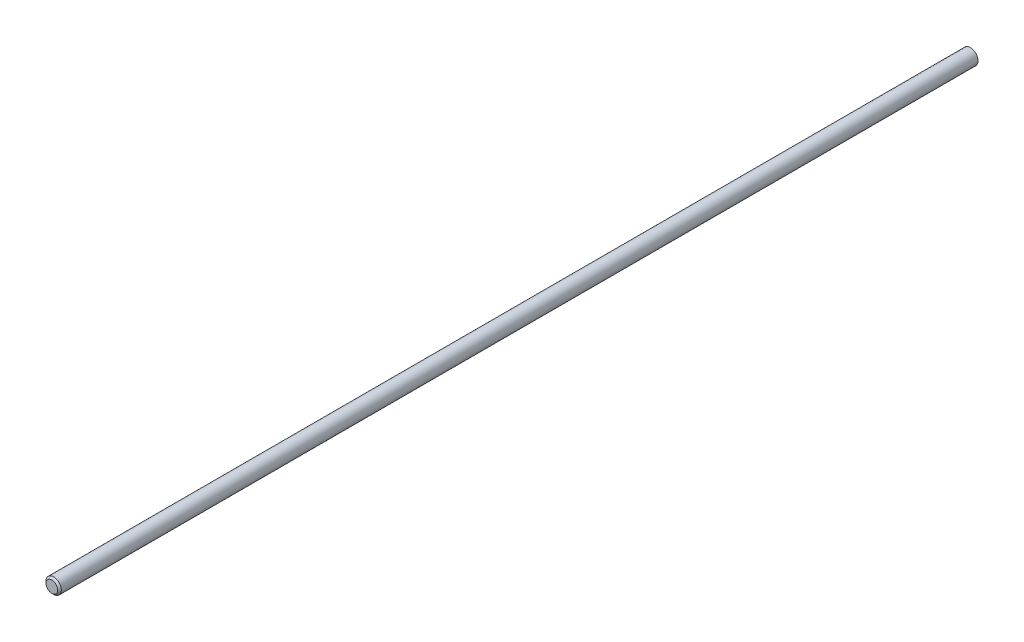
from build123d import *

# Parameters (mm, degrees)
SKETCH1_R           = 3.81
BOSS_EXTRUDE1_DEPTH = 381


# Read off the part's stored shape, not the designer's step: 1/4-20 Machine Threads Stud1
with BuildPart() as part:
    # Sketch1 → Boss-Extrude1 (new body)
    with BuildSketch(Plane.XY):
        Circle(SKETCH1_R)
    extrude(amount=BOSS_EXTRUDE1_DEPTH)

    # 1/4-20 Machine Threads Stud1 outline → 1/4-20 Machine Threads Stud1 (revolve, cut)
    with BuildSketch(Plane.XZ):
        Polygon((3.81, 381), (2.41935, 381), (3.175, 380.24435), (3.175, 0), (3.81, 0), align=None)
    revolve(axis=Axis((0, 0, 0), (0, 0, 1)), mode=Mode.SUBTRACT)


solid = part.part
